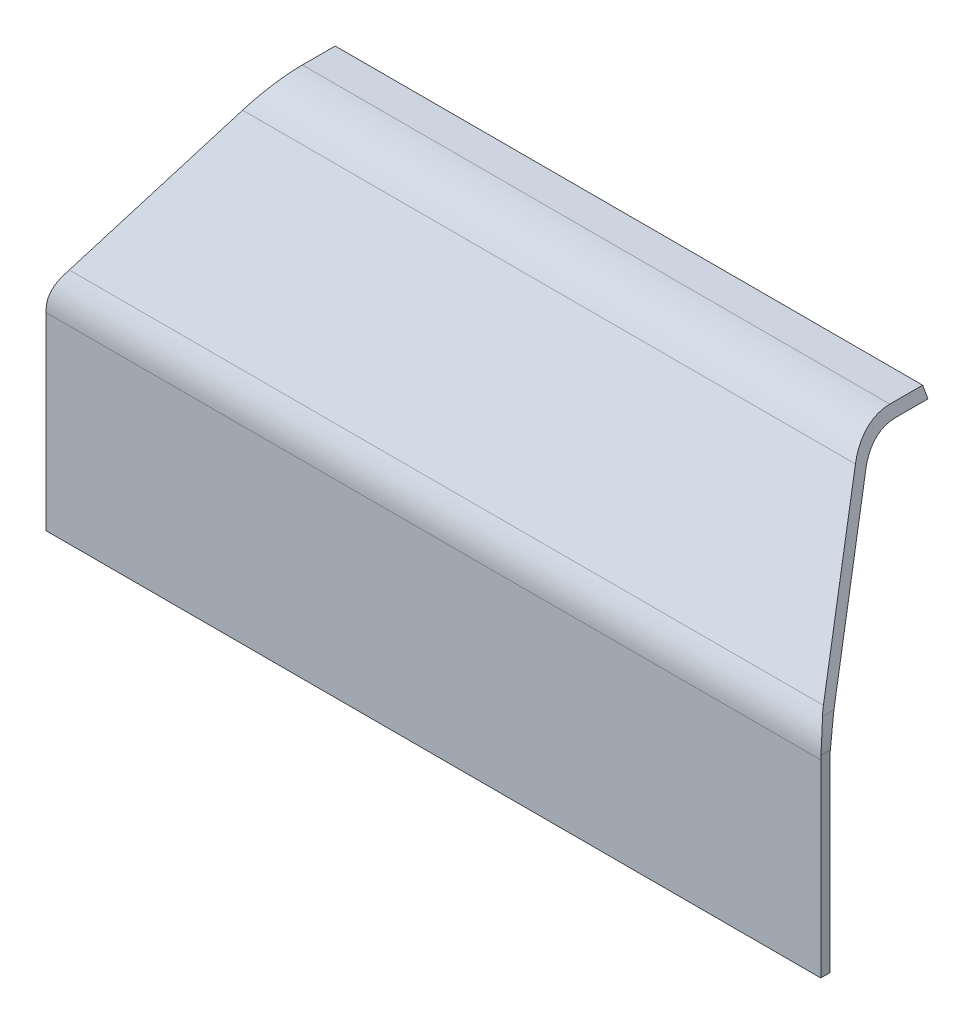
from build123d import *

# Parameters (mm, degrees)
SALIENTE_EXTRUIR1_DEPTH = 126
REDONDEO1_R             = 18
REDONDEO2_R             = 20
REDONDEO3_R             = 17
REDONDEO4_R             = 17
CORTAR_EXTRUIR1_DEPTH   = 186.234557368


with BuildPart() as part:
    # Croquis1 → Saliente-Extruir1 (new, symmetric)
    with BuildSketch(Plane(origin=(0, 0, 0), x_dir=(0, 0, -1), z_dir=(1, 0, 0))):
        Polygon((0, 0), (0, 66.908089297), (41.999818789, 116.961524227), (60.600895814, 116.961524227), (60.600895814, 119.961524227), (40.600895814, 119.961524227), (-3, 68), (-3, 0), align=None)
    extrude(amount=SALIENTE_EXTRUIR1_DEPTH, both=True)

    # Redondeo1
    redondeo1_edges = [part.edges().sort_by_distance(p)[0] for p in [
        (0, 68, 3),
    ]]
    fillet(redondeo1_edges, radius=REDONDEO1_R)

    # Redondeo2
    redondeo2_edges = [part.edges().sort_by_distance(p)[0] for p in [
        (0, 119.961524227, -40.600895814),
    ]]
    fillet(redondeo2_edges, radius=REDONDEO2_R)

    # Redondeo3
    redondeo3_edges = [part.edges().sort_by_distance(p)[0] for p in [
        (0, 116.961524227, -41.999818789),
    ]]
    fillet(redondeo3_edges, radius=REDONDEO3_R)

    # Redondeo4
    redondeo4_edges = [part.edges().sort_by_distance(p)[0] for p in [
        (0, 66.908089297, 0),
    ]]
    fillet(redondeo4_edges, radius=REDONDEO4_R)

    # Croquis2 → Cortar-Extruir1 (cut, through all)
    with BuildSketch(Plane.XY.offset(3)):
        with BuildLine():
            Line((-126, 0), (-126, 62.641016151))
            ThreePointArc((-126, 62.641016151), (-125.420739047, 67.040939918), (-123.722431864, 71.141016151))
            Line((-123.722431864, 71.141016151), (-95.535898385, 119.961524227))
            Line((-95.535898385, 119.961524227), (-129, 119.961524227))
            Line((-129, 119.961524227), (-129, 68))
            Line((-129, 68), (-129, 0))
            Line((-129, 0), (-126, 0))
        make_face()
    cortar_extruir1 = extrude(amount=-CORTAR_EXTRUIR1_DEPTH, mode=Mode.SUBTRACT)

    # Simetría1: Cortar-Extruir1 across plane
    add(cortar_extruir1.mirror(Plane(origin=(0, 0, 0), x_dir=(0, 0, 1), z_dir=(1, 0, 0))), mode=Mode.SUBTRACT)


solid = part.part
